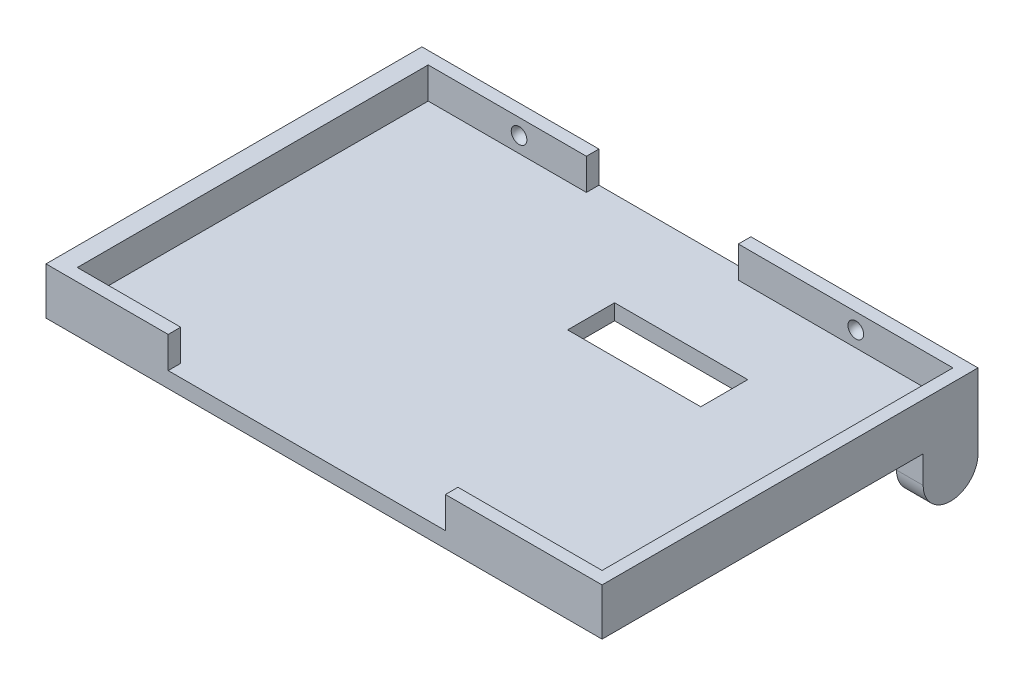
from build123d import *

# Parameters (mm, degrees)
SKETCH_1_W               = 35.5
SKETCH_1_H               = 24
EXTRUDE_1_DEPTH          = 3
SKETCH_2_W               = 31.5
SKETCH_2_H               = 20
CUT_EXTRUDE_1_DEPTH      = 2
SKETCH_4_W               = 1.7
SKETCH_4_H               = 3.5
EXTRUDE_2_DEPTH          = 3.5
CUT_EXTRUDE_3_DEPTH      = 2
CUT_EXTRUDE_4_DEPTH      = 2
CUT_EXTRUDE_START        = -2
CUT_EXTRUDE_5_DEPTH      = 2
CUT_EXTRUDE_6_DEPTH      = 2
SKETCH_10_R              = 0.6
CUT_EXTRUDE_8_DEPTH      = 1.5
SKETCH_11_W              = 8.5
SKETCH_11_H              = 3
CUT_EXTRUDE_9_DEPTH      = 2
CUT_EXTRUDE_START_2      = -1.5
SKETCH_12_R              = 0.6
CUT_EXTRUDE_10_DEPTH     = 1.5
CUT_EXTRUDE_11_DEPTH     = 2
PATTERN_CIRCULAR_3_COUNT = 8
SKETCH_17_W              = 9.7
SKETCH_17_H              = 0.8
CUT_EXTRUDE_12_DEPTH     = 2
SKETCH_18_W              = 17.7
SKETCH_18_H              = 0.8
CUT_EXTRUDE_13_DEPTH     = 2


with BuildPart() as part:
    # 草图1 → 凸台-拉伸1 (new body)
    with BuildSketch(Plane(origin=(0, 0, 0), x_dir=(1, 0, 0), z_dir=(0, 1, 0))):
        Rectangle(SKETCH_1_W, SKETCH_1_H)
    extrude(amount=EXTRUDE_1_DEPTH)

    # 草图2 → 切除-拉伸1 (cut)
    with BuildSketch(Plane(origin=(0, 3, 0), x_dir=(1, 0, 0), z_dir=(0, 1, 0))):
        Rectangle(SKETCH_2_W, SKETCH_2_H)
    extrude(amount=-CUT_EXTRUDE_1_DEPTH, mode=Mode.SUBTRACT)

    # 草图4 → 凸台-拉伸2 (add)
    with BuildSketch(Plane.XZ):
        with Locations((-16.9, -10.25)):
            Rectangle(SKETCH_4_W, SKETCH_4_H)
        with Locations((16.9, -10.25)):
            Rectangle(SKETCH_4_W, SKETCH_4_H)
    extrude(amount=EXTRUDE_2_DEPTH)

    # 草图5 → 切除-拉伸3 (cut)
    with BuildSketch(Plane.ZY.offset(17.75)):
        with BuildLine():
            Line((-12, -1.75), (-12, -3.5))
            Line((-12, -3.5), (-10.25, -3.5))
            ThreePointArc((-10.25, -3.5), (-11.487436867, -2.987436867), (-12, -1.75))
        make_face()
    extrude(amount=-CUT_EXTRUDE_3_DEPTH, mode=Mode.SUBTRACT)

    # 草图6 → 切除-拉伸4 (cut)
    with BuildSketch(Plane.ZY.offset(17.75)):
        with BuildLine():
            Line((-8.5, -3.5), (-10.25, -3.5))
            ThreePointArc((-10.25, -3.5), (-9.012563133, -2.987436867), (-8.5, -1.75))
            Line((-8.5, -1.75), (-8.5, -3.5))
        make_face()
    extrude(amount=-CUT_EXTRUDE_4_DEPTH, mode=Mode.SUBTRACT)

    # 草图7 → 切除-拉伸5 (cut)
    with BuildSketch(Plane(origin=(17.75, 0, 0), x_dir=(0, 0, -1), z_dir=(1, 0, 0)).offset(CUT_EXTRUDE_START)):
        with BuildLine():
            Line((8.5, -3.5), (10.25, -3.5))
            ThreePointArc((10.25, -3.5), (9.012563133, -2.987436867), (8.5, -1.75))
            Line((8.5, -1.75), (8.5, -3.5))
        make_face()
    extrude(amount=CUT_EXTRUDE_5_DEPTH, mode=Mode.SUBTRACT)

    # 草图8 → 切除-拉伸6 (cut)
    with BuildSketch(Plane(origin=(17.75, 0, 0), x_dir=(0, 0, -1), z_dir=(1, 0, 0)).offset(CUT_EXTRUDE_START)):
        with BuildLine():
            Line((12, -3.5), (10.25, -3.5))
            ThreePointArc((10.25, -3.5), (11.487436867, -2.987436867), (12, -1.75))
            Line((12, -1.75), (12, -3.5))
        make_face()
    extrude(amount=CUT_EXTRUDE_6_DEPTH, mode=Mode.SUBTRACT)

    # 草图10 → 切除-拉伸8 (cut)
    with BuildSketch(Plane.ZY.offset(-16.05)):
        with Locations((-10.25, -1.75)):
            Circle(SKETCH_10_R)
    extrude(amount=-CUT_EXTRUDE_8_DEPTH, mode=Mode.SUBTRACT)

    # 草图11 → 切除-拉伸9 (cut)
    with BuildSketch(Plane.XZ):
        with Locations((4.8, -4.5)):
            Rectangle(SKETCH_11_W, SKETCH_11_H)
    extrude(amount=-CUT_EXTRUDE_9_DEPTH, mode=Mode.SUBTRACT)

    # 草图12 → 切除-拉伸10 (cut)
    with BuildSketch(Plane(origin=(-16.05, 0, 0), x_dir=(0, 0, -1), z_dir=(1, 0, 0)).offset(CUT_EXTRUDE_START_2)):
        with Locations((10.25, -1.75)):
            Circle(SKETCH_12_R)
    extrude(amount=CUT_EXTRUDE_10_DEPTH, mode=Mode.SUBTRACT)

    # 草图13 → 切除-拉伸11 (cut)
    with BuildSketch(Plane(origin=(0, 3, 0), x_dir=(1, 0, 0), z_dir=(0, 1, 0))):
        Polygon((-15.678194125, 11.2), (16.95, 11.2), (16.95, -11.2), (-15.75, -11.2), (-16.55, -11.2), (-16.55, 11.2), align=None)
    extrude(amount=-CUT_EXTRUDE_11_DEPTH, mode=Mode.SUBTRACT)

    # 草图14 → 切除-旋转1 (revolve, cut)
    with BuildSketch(Plane.XY.offset(-11.2)):
        with BuildLine():
            Line((-11.25, 2), (-10.25, 2))
            ThreePointArc((-10.25, 2), (-10.75, 2.5), (-11.25, 2))
        make_face()
        with BuildLine():
            Line((10.25, 2), (11.25, 2))
            ThreePointArc((11.25, 2), (10.75, 2.5), (10.25, 2))
        make_face()
    revolve(axis=Axis((10.25, 2, -11.2), (1, 0, 0)), mode=Mode.SUBTRACT)

    # 草图15 → 切除-旋转2 (revolve, cut)
    with BuildSketch(Plane(origin=(0, 0, 11.2), x_dir=(-1, 0, 0), z_dir=(0, 0, -1))):
        with BuildLine():
            Line((10.25, 2), (11.25, 2))
            ThreePointArc((11.25, 2), (10.75, 2.5), (10.25, 2))
        make_face()
        with BuildLine():
            Line((-11.25, 2), (-10.25, 2))
            ThreePointArc((-10.25, 2), (-10.75, 2.5), (-11.25, 2))
        make_face()
    revolve(axis=Axis((11.25, 2, 11.2), (-1, 0, 0)), mode=Mode.SUBTRACT)

    # 草图16 → 切除-旋转3 (revolve, cut)
    with BuildSketch(Plane.ZY.offset(-16.05)):
        with BuildLine():
            Line((-10.5, -0.5), (-10, -0.5))
            ThreePointArc((-10, -0.5), (-10.25, -0.25), (-10.5, -0.5))
        make_face()
    cut_revolve_3 = revolve(axis=Axis((16.05, -0.5, -10.5), (0, 0, 1)), mode=Mode.SUBTRACT)

    # 阵列(圆周)3: 切除-旋转3 ×8 about axis
    pattern_circular_3_axis = Axis((17.55, -1.75, -10.25), (-1, 0, 0))
    for i in range(1, PATTERN_CIRCULAR_3_COUNT):
        add(cut_revolve_3.rotate(pattern_circular_3_axis, i * 360 / PATTERN_CIRCULAR_3_COUNT), mode=Mode.SUBTRACT)

    # 草图17 → 切除-拉伸12 (cut)
    with BuildSketch(Plane(origin=(0, 3, 0), x_dir=(1, 0, 0), z_dir=(0, 1, 0))):
        with Locations((-1.6, 11.6)):
            Rectangle(SKETCH_17_W, SKETCH_17_H)
    extrude(amount=-CUT_EXTRUDE_12_DEPTH, mode=Mode.SUBTRACT)

    # 草图18 → 切除-拉伸13 (cut)
    with BuildSketch(Plane(origin=(0, 3, 0), x_dir=(1, 0, 0), z_dir=(0, 1, 0))):
        with Locations((-1.1, -11.6)):
            Rectangle(SKETCH_18_W, SKETCH_18_H)
    extrude(amount=-CUT_EXTRUDE_13_DEPTH, mode=Mode.SUBTRACT)


solid = part.part
